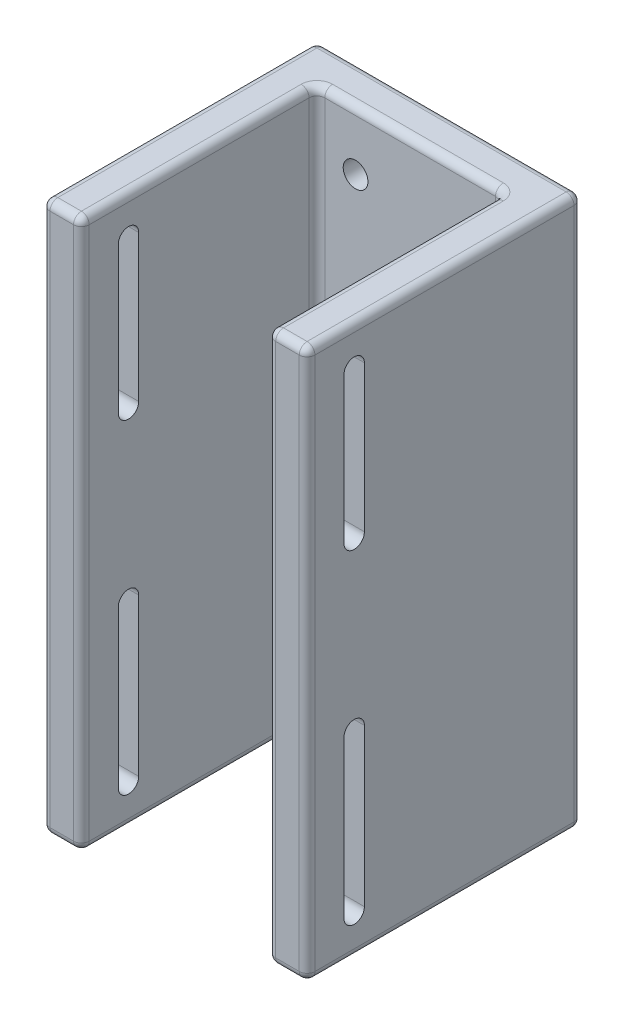
from build123d import *

# Parameters (mm, degrees)
ESQUISSE3_W             = 42.8625
ESQUISSE3_H             = 88.9
BOSS_EXTRU_1_DEPTH      = 6.35
ESQUISSE4_W             = 38.1
ESQUISSE4_H             = 88.9
BOSS_EXTRU_2_DEPTH      = 6.35
CONG_1_R                = 1.27
ESQUISSE5_R             = 2
ENL_V_MAT_EXTRU_1_DEPTH = 63.343491854


with BuildPart() as part:
    # Esquisse3 → Boss.-Extru.1 (new body)
    with BuildSketch(Plane.XY):
        Rectangle(ESQUISSE3_W, ESQUISSE3_H)
    extrude(amount=BOSS_EXTRU_1_DEPTH)

    # Esquisse4 → Boss.-Extru.2 (add)
    with BuildSketch(Plane.ZY.offset(21.43125)):
        with Locations((25.4, 0)):
            Rectangle(ESQUISSE4_W, ESQUISSE4_H)
        with BuildLine():
            ThreePointArc((38.481, -38.1), (36.83, -39.751), (35.179, -38.1))
            Line((35.179, -38.1), (35.179, -12.7))
            ThreePointArc((35.179, -12.7), (36.83, -11.049), (38.481, -12.7))
            Line((38.481, -12.7), (38.481, -38.1))
        make_face(mode=Mode.SUBTRACT)
        with BuildLine():
            ThreePointArc((35.179, 38.1), (36.83, 39.751), (38.481, 38.1))
            Line((38.481, 38.1), (38.481, 14.425740994))
            ThreePointArc((38.481, 14.425740994), (36.83, 12.774740994), (35.179, 14.425740994))
            Line((35.179, 14.425740994), (35.179, 38.1))
        make_face(mode=Mode.SUBTRACT)
    boss_extru_2 = extrude(amount=-BOSS_EXTRU_2_DEPTH)

    # Symétrie1: Boss.-Extru.2 across plane
    add(boss_extru_2.mirror(Plane(origin=(0, 0, 0), x_dir=(0, 0, 1), z_dir=(1, 0, 0))))

    # Congé1
    cong_1_edges = [part.edges().sort_by_distance(p)[0] for p in [
        (-15.08125, -44.45, 25.4),
        (15.08125, -44.45, 25.4),
        (0, -44.45, 6.35),
        (-15.08125, 0, 6.35),
        (0, 44.45, 6.35),
        (15.08125, 0, 6.35),
        (21.43125, 44.45, 22.225),
        (21.43125, -44.45, 22.225),
        (18.25625, -44.45, 44.45),
        (21.43125, 0, 44.45),
        (15.08125, 0, 44.45),
        (-21.43125, -44.45, 22.225),
        (18.25625, 44.45, 44.45),
        (15.08125, 44.45, 25.4),
        (-15.08125, 44.45, 25.4),
        (-21.43125, 44.45, 22.225),
        (0, 44.45, 0),
        (0, -44.45, 0),
        (21.43125, 0, 0),
        (-21.43125, 0, 0),
        (-18.25625, 44.45, 44.45),
        (-18.25625, -44.45, 44.45),
        (-21.43125, 0, 44.45),
        (-15.08125, 0, 44.45),
    ]]
    fillet(cong_1_edges, radius=CONG_1_R)

    # Esquisse5 → Enlèv. mat.-Extru.1 (cut, through all)
    with BuildSketch(Plane.XY.offset(6.35)):
        with Locations((-8.825534845, 34.925)):
            Circle(ESQUISSE5_R)
        with Locations((8.73125, 3.175)):
            Circle(ESQUISSE5_R)
    extrude(amount=-ENL_V_MAT_EXTRU_1_DEPTH, mode=Mode.SUBTRACT)


solid = part.part
